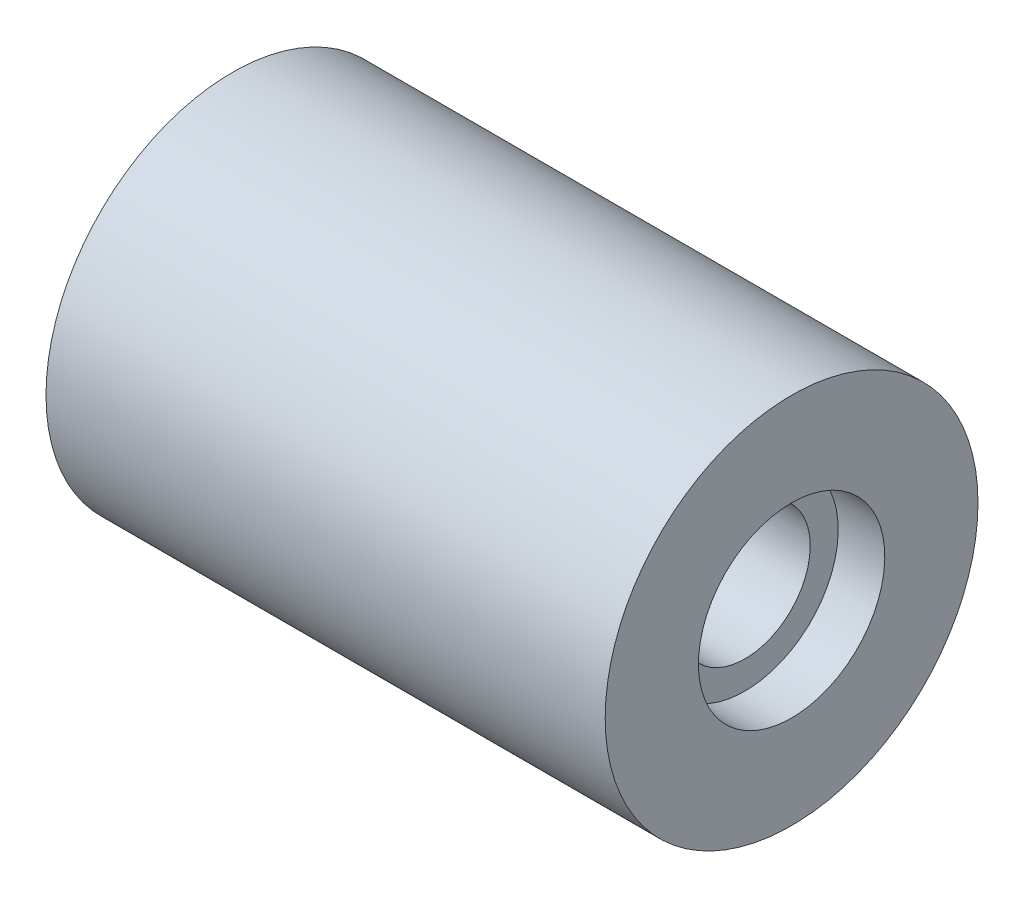
from build123d import *

# Parameters (mm, degrees)
SKETCH2_R           = 25.4
BOSS_EXTRUDE1_DEPTH = 76.2


with BuildPart() as part:
    # Sketch2 → Boss-Extrude1 (new body)
    with BuildSketch(Plane(origin=(0, 0, 0), x_dir=(0, 0, -1), z_dir=(1, 0, 0))):
        Circle(SKETCH2_R)
    extrude(amount=-BOSS_EXTRUDE1_DEPTH)

    # Sketch1 → Cut-Revolve1 (revolve, cut)
    with BuildSketch(Plane.XY):
        Polygon((-30.6578, 10.6299), (-30.6578, 11.9507), (-33.02, 11.9507), (-33.02, 10.6299), (-34.29, 10.6299), (-34.29, 12.7), (-49.53, 12.7), (-49.53, 0), (0, 0), (0, 12.7), (-6.35, 12.7), (-6.35, 8.89), (-21.59, 8.89), (-21.59, 10.6299), (-26.5176, 10.6299), (-26.5176, 11.9507), (-28.8798, 11.9507), (-28.8798, 10.6299), align=None)
    revolve(axis=Axis((0, 0, 0), (-1, 0, 0)), mode=Mode.SUBTRACT)


solid = part.part
